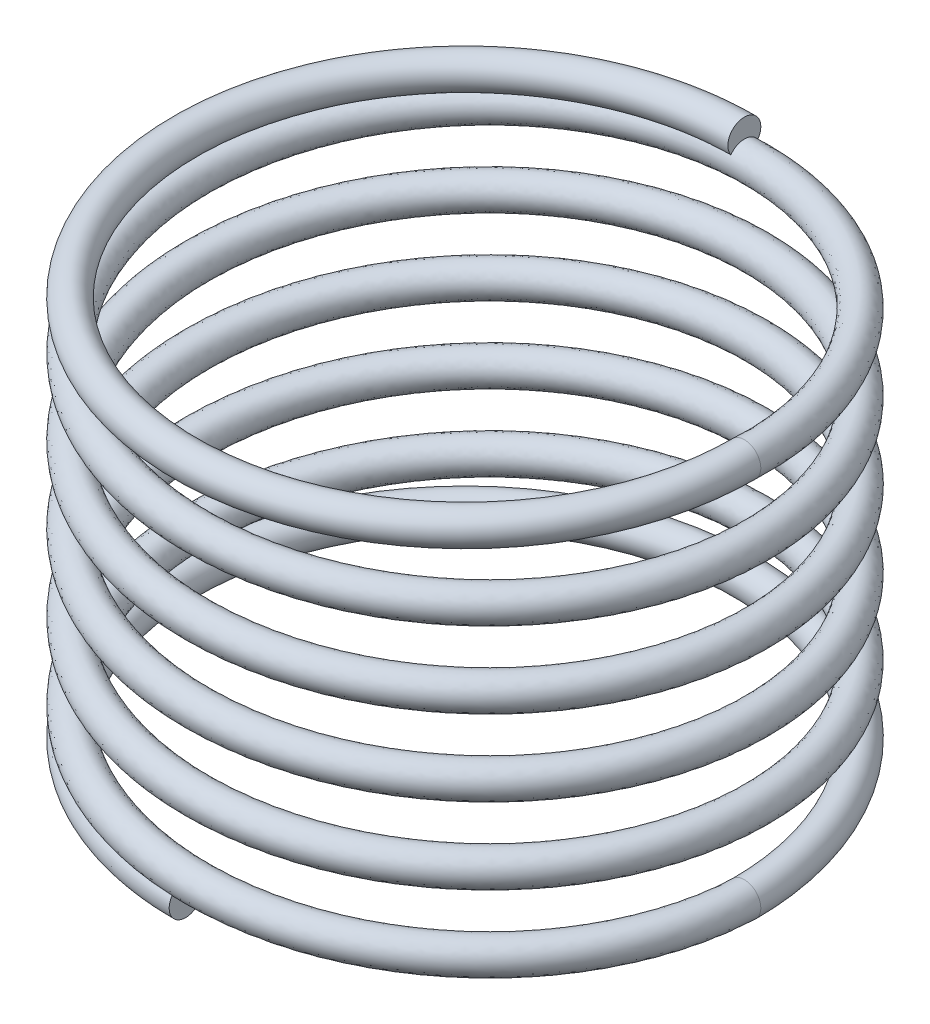
from build123d import *

# Parameters (mm, degrees)
SWEEP1_PITCH       = 4.81584
SWEEP1_HEIGHT      = 24.0792
SWEEP1_RADIUS      = 18.6944
SWEEP1_START_ANGLE = 90
SKETCH2_R          = 1.0414
SKETCH3_R          = 1.0414
REVOLVE1_ANGLE     = 270
SKETCH4_R          = 1.0414
REVOLVE2_ANGLE     = 270


with BuildPart() as part:
    # Sweep1: sweep along a helix
    with BuildLine() as sweep1_path:
        add(Helix(SWEEP1_PITCH, SWEEP1_HEIGHT, SWEEP1_RADIUS, center=(0, 0, 0), direction=(0, 1, 0), lefthand=True, mode=Mode.PRIVATE).rotate(Axis((0, 0, 0), (0, 1, 0)), SWEEP1_START_ANGLE))
    # Sketch2 → Sweep1 (sweep)
    with BuildSketch(Plane.XY):
        with Locations((17.653, 0)):
            Circle(SKETCH2_R)
    sweep(path=sweep1_path.line, is_frenet=True)

    # Sketch3 → Revolve1 (revolve)
    with BuildSketch(Plane.XY):
        with Locations((17.653, 24.0792)):
            Circle(SKETCH3_R)
    revolve(axis=Axis((0, 0, 0), (0, -1, 0)), revolution_arc=REVOLVE1_ANGLE)

    # Sketch4 → Revolve2 (revolve)
    with BuildSketch(Plane.XY):
        with Locations((17.653, 0)):
            Circle(SKETCH4_R)
    revolve(axis=Axis((0, 0, 0), (0, 1, 0)), revolution_arc=REVOLVE2_ANGLE)


solid = part.part
